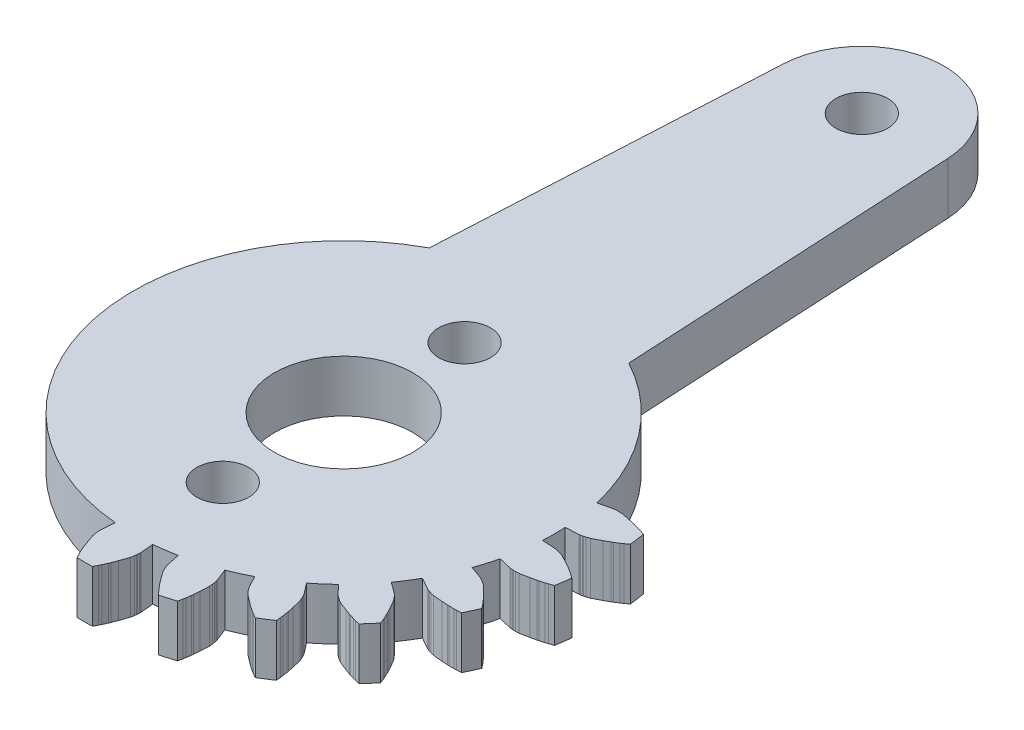
from build123d import *

# Parameters (mm, degrees)
EXTRUDE_1_DEPTH          = 3
SKETCH_2_R               = 12.1875
SKETCH_2_R_2             = 4
SKETCH_2_R_3             = 1.5
EXTRUDE_2_DEPTH          = 3
PATTERN_CIRCULAR_2_COUNT = 22
SKETCH_5_R               = 1.5
EXTRUDE_3_DEPTH          = 3
CUT_EXTRUDE_1_DEPTH      = 3


with BuildPart() as part:
    # 草图1 → 凸台-拉伸1 (new body)
    with BuildSketch(Plane(origin=(0, 0, 0), x_dir=(1, 0, 0), z_dir=(0, 1, 0))):
        with BuildLine():
            Line((39.751048724, 40.522419067), (39.686554084, 41.267856945))
            Line((39.686554084, 41.267856945), (39.685130687, 41.328679419))
            Line((39.685130687, 41.328679419), (39.685864546, 41.357680475))
            Line((39.685864546, 41.357680475), (39.691646479, 41.452849434))
            Line((39.691646479, 41.452849434), (39.692944909, 41.469767126))
            Line((39.692944909, 41.469767126), (39.696597708, 41.504162575))
            Line((39.696597708, 41.504162575), (39.712000694, 41.625842063))
            Line((39.712000694, 41.625842063), (39.748222719, 41.824728347))
            ThreePointArc((39.748222719, 41.824728347), (39.836788564, 42.08141601), (39.929464983, 42.336648348))
            Line((39.929464983, 42.336648348), (40.043958498, 42.644244873))
            Line((40.043958498, 42.644244873), (40.045380324, 42.647784709))
            Line((40.045380324, 42.647784709), (40.085544561, 42.739845233))
            Line((40.085544561, 42.739845233), (40.199519113, 42.997146045))
            ThreePointArc((40.199519113, 42.997146045), (40.23147084, 43.066367201), (40.265346714, 43.134667321))
            ThreePointArc((40.265346714, 43.134667321), (40.328973011, 43.256230012), (40.394481299, 43.376788951))
            ThreePointArc((40.394481299, 43.376788951), (40.835680824, 43.383278913), (41.276880349, 43.376788932))
            ThreePointArc((41.276880349, 43.376788932), (41.342388638, 43.256229993), (41.406014935, 43.134667302))
            ThreePointArc((41.406014935, 43.134667302), (41.439890808, 43.066367181), (41.471842535, 42.997146026))
            Line((41.471842535, 42.997146026), (41.585817087, 42.739845214))
            Line((41.585817087, 42.739845214), (41.625981324, 42.647784689))
            Line((41.625981324, 42.647784689), (41.62740315, 42.644244854))
            Line((41.62740315, 42.644244854), (41.741896665, 42.336648329))
            ThreePointArc((41.741896665, 42.336648329), (41.834572754, 42.081415998), (41.923138271, 41.824728347))
            Line((41.923138271, 41.824728347), (41.959360296, 41.625842063))
            Line((41.959360296, 41.625842063), (41.974763282, 41.504162575))
            Line((41.974763282, 41.504162575), (41.978416081, 41.469767126))
            Line((41.978416081, 41.469767126), (41.979714511, 41.452849434))
            Line((41.979714511, 41.452849434), (41.985496444, 41.357680475))
            Line((41.985496444, 41.357680475), (41.986230303, 41.328679419))
            Line((41.986230303, 41.328679419), (41.984806906, 41.267856945))
            Line((41.984806906, 41.267856945), (41.920312266, 40.522419067))
            ThreePointArc((41.920312266, 40.522419067), (40.835680495, 40.570778645), (39.751048724, 40.522419067))
        make_face()
    extrude_1 = extrude(amount=EXTRUDE_1_DEPTH)

    # 草图2 → 凸台-拉伸2 (add)
    with BuildSketch(Plane.XZ):
        with Locations((40.835680495, -28.383278645)):
            Circle(SKETCH_2_R)
        with Locations((40.835680495, -28.383278645)):
            Circle(SKETCH_2_R_2, mode=Mode.SUBTRACT)
        with Locations((40.835680495, -21.383278645)):
            Circle(SKETCH_2_R_3, mode=Mode.SUBTRACT)
        with Locations((40.835680495, -35.383278645)):
            Circle(SKETCH_2_R_3, mode=Mode.SUBTRACT)
    extrude(amount=-EXTRUDE_2_DEPTH)

    # 阵列(圆周)2: 凸台-拉伸1 ×22 about axis
    pattern_circular_2_axis = Axis((40.835680495, 3, -28.383278645), (0, -1, 0))
    for i in range(1, PATTERN_CIRCULAR_2_COUNT):
        add(extrude_1.rotate(pattern_circular_2_axis, i * 360 / PATTERN_CIRCULAR_2_COUNT))

    # 草图5 → 凸台-拉伸3 (add)
    with BuildSketch(Plane.XZ):
        with BuildLine():
            Line((45.585680495, -58.632739942), (46.610680495, -39.115684305))
            ThreePointArc((46.610680495, -39.115684305), (40.835680495, -40.570778645), (35.060680495, -39.115684305))
            Line((35.060680495, -39.115684305), (36.085680495, -58.632739942))
            ThreePointArc((36.085680495, -58.632739942), (40.835680495, -63.13982476), (45.585680495, -58.632739942))
        make_face()
        with Locations((40.835680495, -58.383278645)):
            Circle(SKETCH_5_R, mode=Mode.SUBTRACT)
    extrude(amount=-EXTRUDE_3_DEPTH)

    # 草图7 → 切除-拉伸1 (cut)
    with BuildSketch(Plane.XZ):
        with BuildLine():
            Line((35.060680495, -39.115684305), (35.075125418, -39.390730508))
            Line((35.075125418, -39.390730508), (34.836458203, -39.843740301))
            Line((34.836458203, -39.843740301), (33.621076182, -45.069775655))
            Line((33.621076182, -45.069775655), (23.29469854, -35.421541283))
            Line((23.29469854, -35.421541283), (25.189109524, -22.168156693))
            Line((25.189109524, -22.168156693), (31.430752441, -11.204000881))
            Line((31.430752441, -11.204000881), (37.969616449, -9.816969122))
            Line((37.969616449, -9.816969122), (39.751048724, -16.244138224))
            ThreePointArc((39.751048724, -16.244138224), (28.89664611, -25.93488852), (35.060680495, -39.115684305))
        make_face()
        with BuildLine():
            Line((46.610680495, -39.115684305), (46.596235572, -39.390730508))
            Line((46.596235572, -39.390730508), (47.014217925, -42.363226189))
            Line((47.014217925, -42.363226189), (53.527706743, -41.712847694))
            Line((53.527706743, -41.712847694), (55.437535773, -32.439444059))
            Line((55.437535773, -32.439444059), (52.32840334, -32.439444059))
            ThreePointArc((52.32840334, -32.439444059), (50.09238666, -36.31098621), (46.610680495, -39.115684305))
        make_face()
    extrude(amount=-CUT_EXTRUDE_1_DEPTH, mode=Mode.SUBTRACT)


solid = part.part
